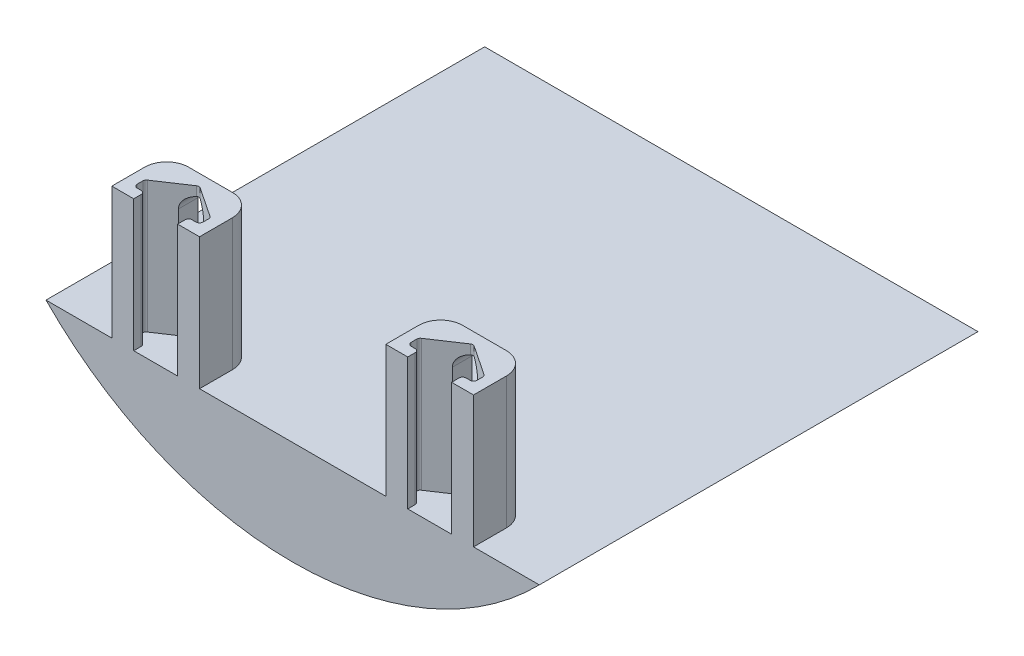
from build123d import *

# Parameters (mm, degrees)
BOSS_EXTRUDE1_DEPTH = 127
BOSS_EXTRUDE2_DEPTH = 38.1
FILLET1_R           = 1
CUT_EXTRUDE1_DEPTH  = 166.676690047


# Read off the part's stored shape, not the designer's step: Mirror1
with BuildPart() as part:
    # Sketch2 → Boss-Extrude1 (new body)
    with BuildSketch(Plane.XY):
        with BuildLine():
            Line((-71.414284285, -70), (71.414284285, -70))
            ThreePointArc((71.414284285, -70), (0, -100), (-71.414284285, -70))
        make_face()
    extrude(amount=BOSS_EXTRUDE1_DEPTH)

    # Sketch3 → Boss-Extrude2 (add)
    with BuildSketch(Plane(origin=(0, -70, 0), x_dir=(1, 0, 0), z_dir=(0, 1, 0))):
        with BuildLine():
            Line((-52.364284285, -127), (-52.364284285, -117.475))
            ThreePointArc((-52.364284285, -117.475), (-50.504412346, -112.984871939), (-46.014284285, -111.125))
            Line((-46.014284285, -111.125), (-33.314284285, -111.125))
            ThreePointArc((-33.314284285, -111.125), (-28.824156225, -112.984871939), (-26.964284285, -117.475))
            Line((-26.964284285, -117.475), (-26.964284285, -127))
            Line((-26.964284285, -127), (-33.314284285, -127))
            Line((-33.314284285, -127), (-33.314284285, -123.825))
            Line((-33.314284285, -123.825), (-30.139284285, -123.825))
            Line((-30.139284285, -123.825), (-30.139284285, -120.65))
            Line((-30.139284285, -120.65), (-39.664284285, -114.3))
            Line((-39.664284285, -114.3), (-49.189284285, -120.65))
            Line((-49.189284285, -120.65), (-49.189284285, -123.825))
            Line((-49.189284285, -123.825), (-46.014284285, -123.825))
            Line((-46.014284285, -123.825), (-46.014284285, -127))
            Line((-46.014284285, -127), (-52.364284285, -127))
        make_face()
    extrude(amount=BOSS_EXTRUDE2_DEPTH)

    # Fillet1
    fillet1_edges = [part.edges().sort_by_distance(p)[0] for p in [
        (-46.014284285, -50.95, 123.825),
        (-49.189284285, -50.95, 123.825),
        (-49.189284285, -50.95, 120.65),
        (-39.664284285, -50.95, 114.3),
        (-30.139284285, -50.95, 120.65),
        (-30.139284285, -50.95, 123.825),
        (-33.314284285, -50.95, 123.825),
    ]]
    fillet(fillet1_edges, radius=FILLET1_R)

    # Sketch5 → Cut-Extrude1 (cut, symmetric)
    with BuildSketch(Plane(origin=(0, 0, 111.125), x_dir=(-1, 0, 0), z_dir=(0, 0, -1))):
        with BuildLine():
            Line((43.339284285, -38.25), (43.339284285, -63.65))
            ThreePointArc((43.339284285, -63.65), (39.664284285, -67.325), (35.989284285, -63.65))
            Line((35.989284285, -63.65), (35.989284285, -38.25))
            ThreePointArc((35.989284285, -38.25), (39.664284285, -34.575), (43.339284285, -38.25))
        make_face()
    extrude(amount=CUT_EXTRUDE1_DEPTH, both=True, mode=Mode.SUBTRACT)

    # Mirror1: part across plane


with BuildPart() as part_1:
    add(part.part)
    add(part.part.mirror(Plane(origin=(0, 0, 0), x_dir=(0, 0, 1), z_dir=(1, 0, 0))))


solid = part_1.part
